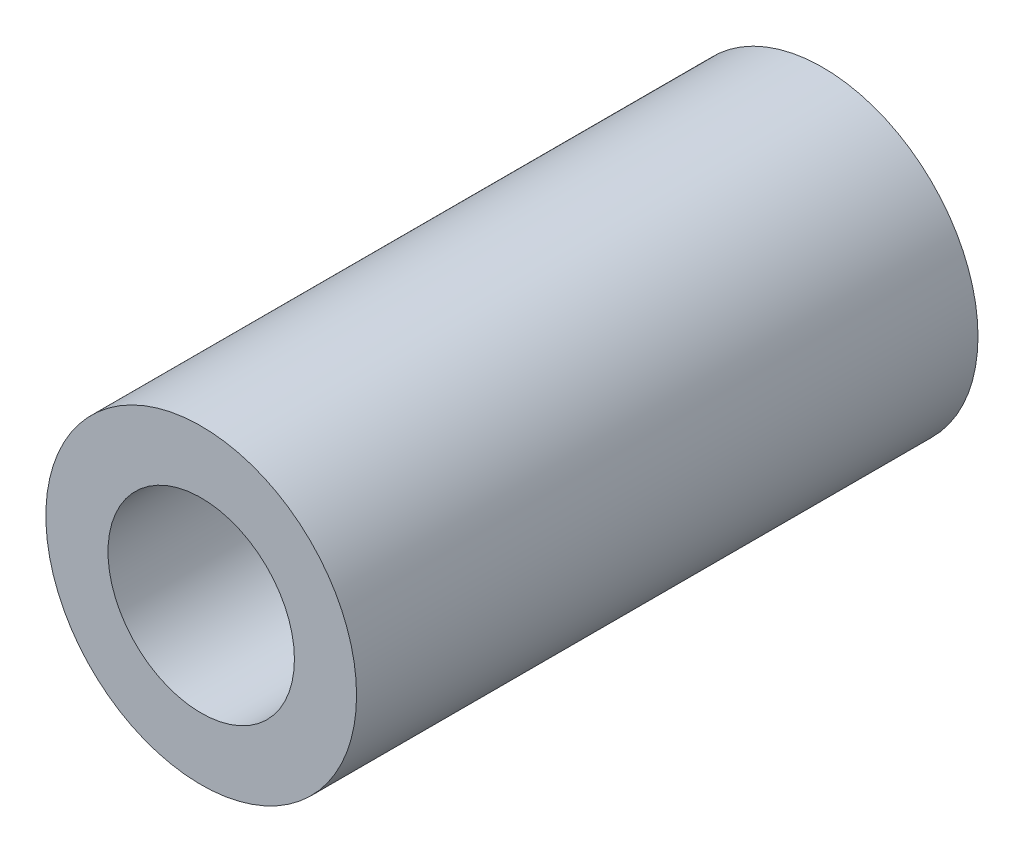
from build123d import *

# Parameters (mm, degrees)
SKETCH1_R           = 5
SKETCH1_R_2         = 3
BOSS_EXTRUDE1_DEPTH = 20


with BuildPart() as part:
    # Sketch1 → Boss-Extrude1 (new body)
    with BuildSketch(Plane.XY):
        Circle(SKETCH1_R)
        Circle(SKETCH1_R_2, mode=Mode.SUBTRACT)
    extrude(amount=BOSS_EXTRUDE1_DEPTH)


solid = part.part
